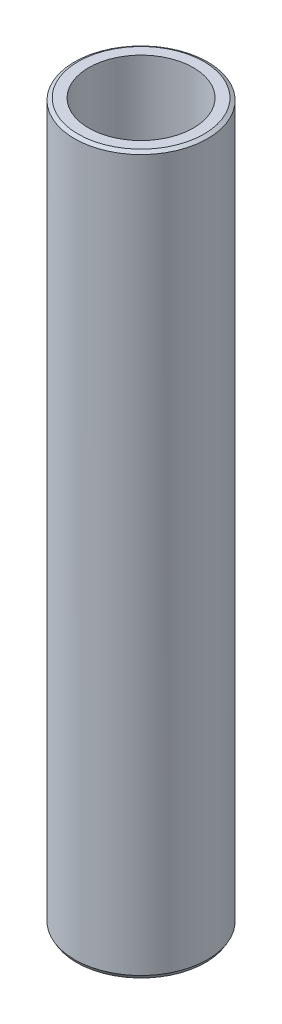
from build123d import *
from OCP.BRepFilletAPI import BRepFilletAPI_MakeChamfer

# Parameters (mm, degrees)
SKETCH1_R           = 45
BOSS_EXTRUDE1_DEPTH = 484.659316945
SKETCH2_R           = 35.40877246
CUT_EXTRUDE1_DEPTH  = 489.81965335
CHAMFER1_SIZE       = 1.428429592
CHAMFER1_SIZE2      = 2.474112628


with BuildPart() as part:
    # Sketch1 → Boss-Extrude1 (new body)
    with BuildSketch(Plane(origin=(0, 0, 0), x_dir=(1, 0, 0), z_dir=(0, 1, 0))):
        Circle(SKETCH1_R)
    extrude(amount=BOSS_EXTRUDE1_DEPTH)

    # Sketch2 → Cut-Extrude1 (cut, through all)
    with BuildSketch(Plane(origin=(0, 0, 0), x_dir=(1, 0, 0), z_dir=(0, 1, 0))):
        Circle(SKETCH2_R)
    extrude(amount=CUT_EXTRUDE1_DEPTH, mode=Mode.SUBTRACT)

    # Chamfer1: one chamfer whose edges measure the first distance from different faces: ONE call of the kernel's chamfer builder (chamfer() names one face for all edges)
    chamfer1_edges_1 = [part.edges().sort_by_distance(p)[0] for p in [
        (-45, 484.659316945, 0),
    ]]
    chamfer1_side_1 = [part.faces().sort_by_distance(p)[0] for p in [
        (-45, 242.329658472, 0),
    ]]
    chamfer1_edges_2 = [part.edges().sort_by_distance(p)[0] for p in [
        (-45, 0, 0),
    ]]
    chamfer1_side_2 = [part.faces().sort_by_distance(p)[0] for p in [
        (-43.727207794, 0, 0),
    ]]
    chamfer1 = BRepFilletAPI_MakeChamfer(part.part.solid().wrapped)
    for e in chamfer1_edges_1:
        chamfer1.Add(CHAMFER1_SIZE, CHAMFER1_SIZE2, e.wrapped, chamfer1_side_1[0].wrapped)  # the first distance lies on this face
    for e in chamfer1_edges_2:
        chamfer1.Add(CHAMFER1_SIZE, CHAMFER1_SIZE2, e.wrapped, chamfer1_side_2[0].wrapped)  # the first distance lies on this face
    add(Compound.cast(chamfer1.Shape()), mode=Mode.REPLACE)


solid = part.part
